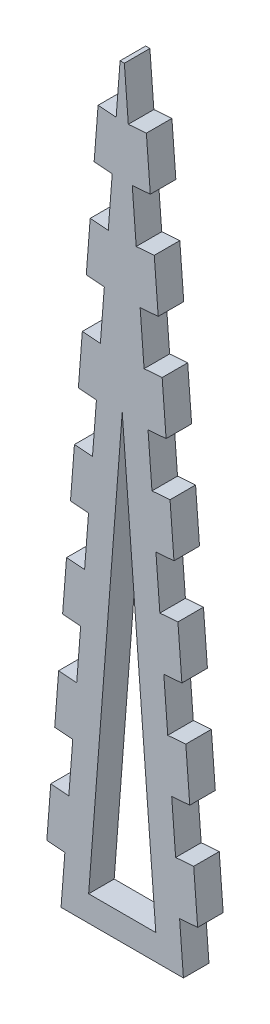
from build123d import *

# Parameters (mm, degrees)
BOSS_EXTRUDE1_DEPTH   = 6.35
CUT_EXTRUDE1_DEPTH    = 258.879971193
LPATTERN1_COUNT       = 9
LPATTERN1_PITCH       = 25.4
CUT_EXTRUDE2_DEPTH    = 258.879971193
LPATTERN3_START       = -252.481631985
LPATTERN3_OUTLINE_W   = 4.50356866
LPATTERN3_OUTLINE_H   = 6.35
LPATTERN3_DEPTH       = 52.327499141
LPATTERN3_START_2     = -187.454132844
LPATTERN3_2_OUTLINE_W = 4.50356866
LPATTERN3_2_OUTLINE_H = 6.35
LPATTERN3_2_DEPTH     = 12.7
LPATTERN3_START_3     = -162.054132844
LPATTERN3_3_OUTLINE_W = 4.50356866
LPATTERN3_3_OUTLINE_H = 6.35
LPATTERN3_3_DEPTH     = 12.7
LPATTERN3_START_4     = -136.654132844
LPATTERN3_4_OUTLINE_W = 4.50356866
LPATTERN3_4_OUTLINE_H = 6.35
LPATTERN3_4_DEPTH     = 12.7
LPATTERN3_START_5     = -111.254132844
LPATTERN3_5_OUTLINE_W = 4.50356866
LPATTERN3_5_OUTLINE_H = 6.35
LPATTERN3_5_DEPTH     = 12.7
LPATTERN3_START_6     = -85.854132844
LPATTERN3_6_OUTLINE_W = 4.50356866
LPATTERN3_6_OUTLINE_H = 6.35
LPATTERN3_6_DEPTH     = 12.7
LPATTERN3_START_7     = -60.454132844
LPATTERN3_7_OUTLINE_W = 4.50356866
LPATTERN3_7_OUTLINE_H = 6.35
LPATTERN3_7_DEPTH     = 12.7
LPATTERN3_START_8     = -35.054132844
LPATTERN3_8_OUTLINE_W = 4.50356866
LPATTERN3_8_OUTLINE_H = 6.35
LPATTERN3_8_DEPTH     = 12.7
LPATTERN3_START_9     = -225.661600657
LPATTERN3_9_OUTLINE_W = 2.832525799
LPATTERN3_9_OUTLINE_H = 6.35
LPATTERN3_9_DEPTH     = 13.028393953
SKETCH4_W             = 28.782231323
SKETCH4_H             = 17.896251878
CUT_EXTRUDE3_DEPTH    = 207.312084539
CUT_EXTRUDE4_DEPTH    = 194.552412762


# Read off the part's stored shape, not the designer's step: LPattern3
with BuildPart() as part:
    # Sketch1 → Boss-Extrude1 (new body)
    with BuildSketch(Plane.XY):
        Polygon((19.726920908, 254.76489438), (0, 0), (39.453841816, 0), align=None)
    extrude(amount=BOSS_EXTRUDE1_DEPTH)

    # Sketch2 → Cut-Extrude1 (cut, through all)
    with BuildSketch(Plane.XY.offset(6.35)):
        Polygon((0, 0), (0.98044984, 12.662097698), (5.4705779, 12.314418708), (4.490128061, -0.34767899), align=None)
    cut_extrude1 = extrude(amount=-CUT_EXTRUDE1_DEPTH, mode=Mode.SUBTRACT)

    # LPattern1: Cut-Extrude1 ×9
    with Locations(*[Vector(0.07720077476736964, 0.9970155667667973, 0) * (i * LPATTERN1_PITCH) for i in range(1, LPATTERN1_COUNT)]):
        add(cut_extrude1, mode=Mode.SUBTRACT)

    # Sketch3 → Cut-Extrude2 (cut, through all)
    with BuildSketch(Plane.XY.offset(6.35)):
        Polygon((39.453841816, 0), (38.473391976, 12.662097698), (33.983263916, 12.314418708), (34.963713756, -0.34767899), align=None)
    extrude(amount=-CUT_EXTRUDE2_DEPTH, mode=Mode.SUBTRACT)

    # LPattern3 outline → LPattern3 (cut)
    with BuildSketch(Plane(origin=(0, 0, 0), x_dir=(0.9970155667667971, 0.07720077476736921, 0), z_dir=(0.07720077476736921, -0.9970155667667973, 0)).offset(LPATTERN3_START)):
        with Locations((37.084310129, 3.175)):
            Rectangle(LPATTERN3_OUTLINE_W, LPATTERN3_OUTLINE_H)
    extrude(amount=LPATTERN3_DEPTH, mode=Mode.SUBTRACT)

    # LPattern3 2 outline → LPattern3 2 (cut)
    with BuildSketch(Plane(origin=(0, 0, 0), x_dir=(0.9970155667667971, 0.07720077476736921, 0), z_dir=(0.07720077476736921, -0.9970155667667973, 0)).offset(LPATTERN3_START_2)):
        with Locations((37.084310129, 3.175)):
            Rectangle(LPATTERN3_2_OUTLINE_W, LPATTERN3_2_OUTLINE_H)
    extrude(amount=LPATTERN3_2_DEPTH, mode=Mode.SUBTRACT)

    # LPattern3 3 outline → LPattern3 3 (cut)
    with BuildSketch(Plane(origin=(0, 0, 0), x_dir=(0.9970155667667971, 0.07720077476736921, 0), z_dir=(0.07720077476736921, -0.9970155667667973, 0)).offset(LPATTERN3_START_3)):
        with Locations((37.084310129, 3.175)):
            Rectangle(LPATTERN3_3_OUTLINE_W, LPATTERN3_3_OUTLINE_H)
    extrude(amount=LPATTERN3_3_DEPTH, mode=Mode.SUBTRACT)

    # LPattern3 4 outline → LPattern3 4 (cut)
    with BuildSketch(Plane(origin=(0, 0, 0), x_dir=(0.9970155667667971, 0.07720077476736921, 0), z_dir=(0.07720077476736921, -0.9970155667667973, 0)).offset(LPATTERN3_START_4)):
        with Locations((37.084310129, 3.175)):
            Rectangle(LPATTERN3_4_OUTLINE_W, LPATTERN3_4_OUTLINE_H)
    extrude(amount=LPATTERN3_4_DEPTH, mode=Mode.SUBTRACT)

    # LPattern3 5 outline → LPattern3 5 (cut)
    with BuildSketch(Plane(origin=(0, 0, 0), x_dir=(0.9970155667667971, 0.07720077476736921, 0), z_dir=(0.07720077476736921, -0.9970155667667973, 0)).offset(LPATTERN3_START_5)):
        with Locations((37.084310129, 3.175)):
            Rectangle(LPATTERN3_5_OUTLINE_W, LPATTERN3_5_OUTLINE_H)
    extrude(amount=LPATTERN3_5_DEPTH, mode=Mode.SUBTRACT)

    # LPattern3 6 outline → LPattern3 6 (cut)
    with BuildSketch(Plane(origin=(0, 0, 0), x_dir=(0.9970155667667971, 0.07720077476736921, 0), z_dir=(0.07720077476736921, -0.9970155667667973, 0)).offset(LPATTERN3_START_6)):
        with Locations((37.084310129, 3.175)):
            Rectangle(LPATTERN3_6_OUTLINE_W, LPATTERN3_6_OUTLINE_H)
    extrude(amount=LPATTERN3_6_DEPTH, mode=Mode.SUBTRACT)

    # LPattern3 7 outline → LPattern3 7 (cut)
    with BuildSketch(Plane(origin=(0, 0, 0), x_dir=(0.9970155667667971, 0.07720077476736921, 0), z_dir=(0.07720077476736921, -0.9970155667667973, 0)).offset(LPATTERN3_START_7)):
        with Locations((37.084310129, 3.175)):
            Rectangle(LPATTERN3_7_OUTLINE_W, LPATTERN3_7_OUTLINE_H)
    extrude(amount=LPATTERN3_7_DEPTH, mode=Mode.SUBTRACT)

    # LPattern3 8 outline → LPattern3 8 (cut)
    with BuildSketch(Plane(origin=(0, 0, 0), x_dir=(0.9970155667667971, 0.07720077476736921, 0), z_dir=(0.07720077476736921, -0.9970155667667973, 0)).offset(LPATTERN3_START_8)):
        with Locations((37.084310129, 3.175)):
            Rectangle(LPATTERN3_8_OUTLINE_W, LPATTERN3_8_OUTLINE_H)
    extrude(amount=LPATTERN3_8_DEPTH, mode=Mode.SUBTRACT)

    # LPattern3 9 outline → LPattern3 9 (cut)
    with BuildSketch(Plane(origin=(0, 0, 0), x_dir=(0.9970155667667971, 0.07720077476736921, 0), z_dir=(0.07720077476736921, -0.9970155667667973, 0)).offset(LPATTERN3_START_9)):
        with Locations((33.416262899, 3.175)):
            Rectangle(LPATTERN3_9_OUTLINE_W, LPATTERN3_9_OUTLINE_H)
    extrude(amount=LPATTERN3_9_DEPTH, mode=Mode.SUBTRACT)

    # Sketch4 → Cut-Extrude3 (cut, through all)
    with BuildSketch(Plane.XY.offset(6.35)):
        with Locations((18.872321894, 198.531912418)):
            Rectangle(SKETCH4_W, SKETCH4_H)
    extrude(amount=-CUT_EXTRUDE3_DEPTH, mode=Mode.SUBTRACT)

    # Sketch5 → Cut-Extrude4 (cut, through all)
    with BuildSketch(Plane.XY.offset(6.35)):
        Polygon((19.726920908, 114.176037685), (11.377749715, 6.35), (28.076092101, 6.35), align=None)
    extrude(amount=-CUT_EXTRUDE4_DEPTH, mode=Mode.SUBTRACT)


solid = part.part
